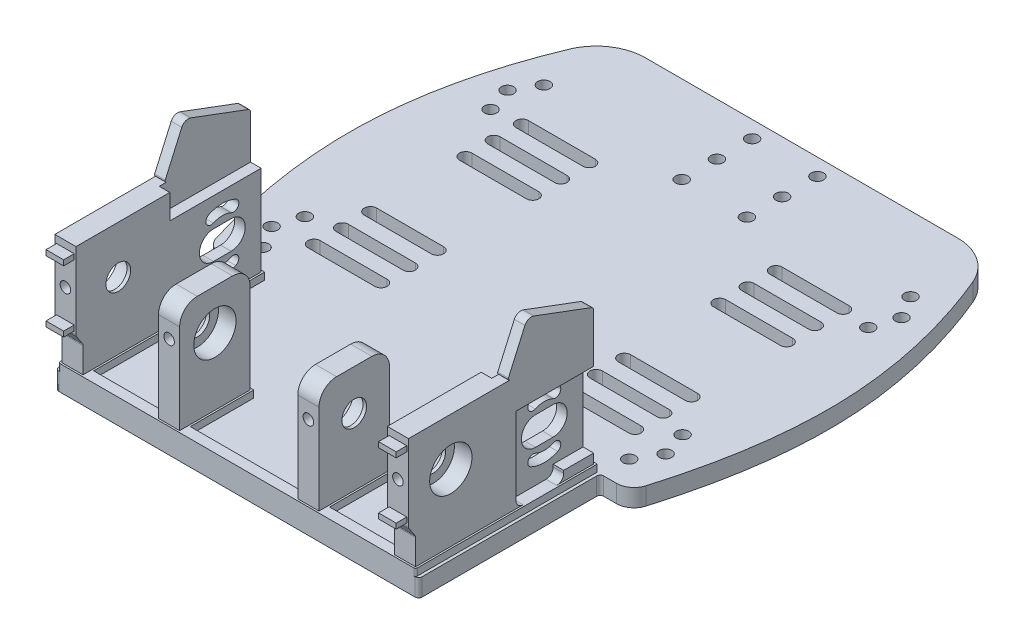
from build123d import *

# Parameters (mm, degrees)
SKETCH_2_R           = 1.75
EXTRUDE_1_DEPTH      = 5
EXTRUDE_2_DEPTH      = 2
SKETCH_7_W           = 6
SKETCH_7_H           = 50.5
EXTRUDE_3_DEPTH      = 39.5
SKETCH_8_W           = 6
SKETCH_8_H           = 20
EXTRUDE_4_DEPTH      = 37.5
FILLET_1_R           = 5
SKETCH_9_R           = 1.5
CUT_EXTRUDE_1_DEPTH  = 4
EXTRUDE_6_DEPTH      = 6
EXTRUDE_START        = -6
EXTRUDE_7_DEPTH      = 6
SKETCH_12_R          = 1.5
CUT_EXTRUDE_2_DEPTH  = 6
EXTRUDE_8_DEPTH      = 3
EXTRUDE_START_2      = -3
EXTRUDE_9_DEPTH      = 3
SKETCH_15_W          = 5
SKETCH_15_H          = 1.5
EXTRUDE_10_DEPTH     = 3
SKETCH_16_W          = 25.9
SKETCH_16_H          = 7
CUT_EXTRUDE_3_DEPTH  = 3
SKETCH_17_W          = 25.9
SKETCH_17_H          = 7
CUT_EXTRUDE_4_DEPTH  = 3
CUT_EXTRUDE_5_DEPTH  = 3
CUT_EXTRUDE_START    = -3
CUT_EXTRUDE_6_DEPTH  = 3
CUT_EXTRUDE_7_DEPTH  = 168.705640987
CUT_EXTRUDE_8_DEPTH  = 168.705640987
SKETCH_26_R          = 3.5
CUT_EXTRUDE_9_DEPTH  = 170.779431891
SKETCH_27_R          = 6
CUT_EXTRUDE_10_DEPTH = 5
CUT_EXTRUDE_START_2  = -5
SKETCH_28_R          = 6
CUT_EXTRUDE_11_DEPTH = 5
SKETCH_29_R          = 6
CUT_EXTRUDE_12_DEPTH = 5
SKETCH_30_R          = 6
CUT_EXTRUDE_13_DEPTH = 5


with BuildPart() as part:
    # 草图2 → 凸台-拉伸1 (new body)
    with BuildSketch(Plane(origin=(0, 0, 0), x_dir=(1, 0, 0), z_dir=(0, 1, 0))):
        with BuildLine():
            Line((56.113755452, -54.3), (52.5, -54.3))
            ThreePointArc((52.5, -54.3), (51.792893219, -54.592893219), (51.5, -55.3))
            Line((51.5, -55.3), (51.5, -104.8))
            ThreePointArc((51.5, -104.8), (51.207106781, -105.507106781), (50.5, -105.8))
            Line((50.5, -105.8), (-50.5, -105.8))
            ThreePointArc((-50.5, -105.8), (-51.207106781, -105.507106781), (-51.5, -104.8))
            Line((-51.5, -104.8), (-51.5, -55.3))
            ThreePointArc((-51.5, -55.3), (-51.792893219, -54.592893219), (-52.5, -54.3))
            Line((-52.5, -54.3), (-56.113755452, -54.3))
            ThreePointArc((-56.113755452, -54.3), (-59.107373243, -53.304778711), (-60.909266171, -50.71530101))
            add(Edge.make_bspline(
                [(-57.171649595, 45.680899892), (-63.360092461, 30.816601844), (-71.169761296, -1.401110068), (-65.950978808, -33.632301117), (-60.909266171, -50.71530101)],
                knots=[0.081627744, 0.081627744, 0.081627744, 0.081627744, 0.502660911, 0.9620676, 0.9620676, 0.9620676, 0.9620676], degree=3))
            ThreePointArc((-57.171649595, 45.680899892), (-52.014502293, 51.947587701), (-44.247025177, 54.3))
            Line((-44.247025177, 54.3), (44.247025177, 54.3))
            ThreePointArc((44.247025177, 54.3), (52.014502293, 51.947587701), (57.171649595, 45.680899892))
            add(Edge.make_bspline(
                [(57.171649595, 45.680899892), (63.360092461, 30.816601844), (71.169761296, -1.401110068), (65.950978808, -33.632301117), (60.909266171, -50.71530101)],
                knots=[0.081627744, 0.081627744, 0.081627744, 0.081627744, 0.502660911, 0.9620676, 0.9620676, 0.9620676, 0.9620676], degree=3))
            ThreePointArc((60.909266171, -50.71530101), (59.107373243, -53.304778711), (56.113755452, -54.3))
        make_face()
        with Locations((-9.25, 49.55)):
            Circle(SKETCH_2_R, mode=Mode.SUBTRACT)
        with Locations((-9.25, 39.55)):
            Circle(SKETCH_2_R, mode=Mode.SUBTRACT)
        with Locations((-9.25, 29.55)):
            Circle(SKETCH_2_R, mode=Mode.SUBTRACT)
        with Locations((-51.988325541, 33.215001872)):
            Circle(SKETCH_2_R, mode=Mode.SUBTRACT)
        with Locations((-55.858759328, 26.79084883)):
            Circle(SKETCH_2_R, mode=Mode.SUBTRACT)
        with Locations((-53.5525482, 19.654225663)):
            Circle(SKETCH_2_R, mode=Mode.SUBTRACT)
        with Locations((-51.988325541, -46.55)):
            Circle(SKETCH_2_R, mode=Mode.SUBTRACT)
        with Locations((-55.858759328, -40.125846958)):
            Circle(SKETCH_2_R, mode=Mode.SUBTRACT)
        with Locations((-53.5525482, -32.989223791)):
            Circle(SKETCH_2_R, mode=Mode.SUBTRACT)
        with Locations((9.25, 39.55)):
            Circle(SKETCH_2_R, mode=Mode.SUBTRACT)
        with Locations((9.25, 49.55)):
            Circle(SKETCH_2_R, mode=Mode.SUBTRACT)
        with Locations((53.5525482, -32.989223791)):
            Circle(SKETCH_2_R, mode=Mode.SUBTRACT)
        with Locations((55.858759328, -40.125846958)):
            Circle(SKETCH_2_R, mode=Mode.SUBTRACT)
        with Locations((51.988325541, -46.55)):
            Circle(SKETCH_2_R, mode=Mode.SUBTRACT)
        with Locations((53.5525482, 19.654225663)):
            Circle(SKETCH_2_R, mode=Mode.SUBTRACT)
        with Locations((55.858759328, 26.79084883)):
            Circle(SKETCH_2_R, mode=Mode.SUBTRACT)
        with Locations((51.988325541, 33.215001872)):
            Circle(SKETCH_2_R, mode=Mode.SUBTRACT)
        with Locations((9.25, 29.55)):
            Circle(SKETCH_2_R, mode=Mode.SUBTRACT)
        with BuildLine():
            Line((-26.5, 18.8), (-45.5, 18.8))
            ThreePointArc((-45.5, 18.8), (-47.25, 20.55), (-45.5, 22.3))
            Line((-45.5, 22.3), (-26.5, 22.3))
            ThreePointArc((-26.5, 22.3), (-24.75, 20.55), (-26.5, 18.8))
        make_face(mode=Mode.SUBTRACT)
        with BuildLine():
            Line((-26.5, 10.8), (-45.5, 10.8))
            ThreePointArc((-45.5, 10.8), (-47.25, 12.55), (-45.5, 14.3))
            Line((-45.5, 14.3), (-26.5, 14.3))
            ThreePointArc((-26.5, 14.3), (-24.75, 12.55), (-26.5, 10.8))
        make_face(mode=Mode.SUBTRACT)
        with BuildLine():
            Line((-26.5, 2.8), (-45.5, 2.8))
            ThreePointArc((-45.5, 2.8), (-47.25, 4.55), (-45.5, 6.3))
            Line((-45.5, 6.3), (-26.5, 6.3))
            ThreePointArc((-26.5, 6.3), (-24.75, 4.55), (-26.5, 2.8))
        make_face(mode=Mode.SUBTRACT)
        with BuildLine():
            Line((-45.5, -20.7), (-26.5, -20.7))
            ThreePointArc((-26.5, -20.7), (-24.75, -22.45), (-26.5, -24.2))
            Line((-26.5, -24.2), (-45.5, -24.2))
            ThreePointArc((-45.5, -24.2), (-47.25, -22.45), (-45.5, -20.7))
        make_face(mode=Mode.SUBTRACT)
        with BuildLine():
            Line((-45.5, -28.7), (-26.5, -28.7))
            ThreePointArc((-26.5, -28.7), (-24.75, -30.45), (-26.5, -32.2))
            Line((-26.5, -32.2), (-45.5, -32.2))
            ThreePointArc((-45.5, -32.2), (-47.25, -30.45), (-45.5, -28.7))
        make_face(mode=Mode.SUBTRACT)
        with BuildLine():
            Line((-45.5, -36.7), (-26.5, -36.7))
            ThreePointArc((-26.5, -36.7), (-24.75, -38.45), (-26.5, -40.2))
            Line((-26.5, -40.2), (-45.5, -40.2))
            ThreePointArc((-45.5, -40.2), (-47.25, -38.45), (-45.5, -36.7))
        make_face(mode=Mode.SUBTRACT)
        with BuildLine():
            Line((26.5, 18.8), (45.5, 18.8))
            ThreePointArc((45.5, 18.8), (47.25, 20.55), (45.5, 22.3))
            Line((45.5, 22.3), (26.5, 22.3))
            ThreePointArc((26.5, 22.3), (24.75, 20.55), (26.5, 18.8))
        make_face(mode=Mode.SUBTRACT)
        with BuildLine():
            Line((26.5, 10.8), (45.5, 10.8))
            ThreePointArc((45.5, 10.8), (47.25, 12.55), (45.5, 14.3))
            Line((45.5, 14.3), (26.5, 14.3))
            ThreePointArc((26.5, 14.3), (24.75, 12.55), (26.5, 10.8))
        make_face(mode=Mode.SUBTRACT)
        with BuildLine():
            Line((26.5, 2.8), (45.5, 2.8))
            ThreePointArc((45.5, 2.8), (47.25, 4.55), (45.5, 6.3))
            Line((45.5, 6.3), (26.5, 6.3))
            ThreePointArc((26.5, 6.3), (24.75, 4.55), (26.5, 2.8))
        make_face(mode=Mode.SUBTRACT)
        with BuildLine():
            Line((45.5, -20.7), (26.5, -20.7))
            ThreePointArc((26.5, -20.7), (24.75, -22.45), (26.5, -24.2))
            Line((26.5, -24.2), (45.5, -24.2))
            ThreePointArc((45.5, -24.2), (47.25, -22.45), (45.5, -20.7))
        make_face(mode=Mode.SUBTRACT)
        with BuildLine():
            Line((45.5, -28.7), (26.5, -28.7))
            ThreePointArc((26.5, -28.7), (24.75, -30.45), (26.5, -32.2))
            Line((26.5, -32.2), (45.5, -32.2))
            ThreePointArc((45.5, -32.2), (47.25, -30.45), (45.5, -28.7))
        make_face(mode=Mode.SUBTRACT)
        with BuildLine():
            Line((45.5, -36.7), (26.5, -36.7))
            ThreePointArc((26.5, -36.7), (24.75, -38.45), (26.5, -40.2))
            Line((26.5, -40.2), (45.5, -40.2))
            ThreePointArc((45.5, -40.2), (47.25, -38.45), (45.5, -36.7))
        make_face(mode=Mode.SUBTRACT)
    extrude(amount=EXTRUDE_1_DEPTH)

    # 草图5 → 凸台-拉伸2 (add)
    with BuildSketch(Plane(origin=(0, 5, 0), x_dir=(1, 0, 0), z_dir=(0, 1, 0))):
        with BuildLine():
            Line((-43.65, -105.8), (43.65, -105.8))
            Line((43.65, -105.8), (50.15, -105.8))
            ThreePointArc((50.15, -105.8), (50.503553391, -105.653553391), (50.65, -105.3))
            Line((50.65, -105.3), (50.65, -54.3))
            Line((50.65, -54.3), (43.65, -54.3))
            Line((43.65, -54.3), (43.65, -102.8))
            Line((43.65, -102.8), (23.25, -102.8))
            Line((23.25, -102.8), (23.25, -84.8))
            Line((23.25, -84.8), (16.25, -84.8))
            Line((16.25, -84.8), (16.25, -102.8))
            Line((16.25, -102.8), (-16.25, -102.8))
            Line((-16.25, -102.8), (-16.25, -84.8))
            Line((-16.25, -84.8), (-23.25, -84.8))
            Line((-23.25, -84.8), (-23.25, -102.8))
            Line((-23.25, -102.8), (-43.65, -102.8))
            Line((-43.65, -102.8), (-43.65, -54.3))
            Line((-43.65, -54.3), (-50.65, -54.3))
            Line((-50.65, -54.3), (-50.65, -105.3))
            ThreePointArc((-50.65, -105.3), (-50.503553391, -105.653553391), (-50.15, -105.8))
            Line((-50.15, -105.8), (-43.65, -105.8))
        make_face()
    extrude(amount=EXTRUDE_2_DEPTH)

    # 草图7 → 凸台-拉伸3 (add)
    with BuildSketch(Plane.XZ):
        with Locations((-47.15, 80.05)):
            Rectangle(SKETCH_7_W, SKETCH_7_H)
        with Locations((47.15, 80.05)):
            Rectangle(SKETCH_7_W, SKETCH_7_H)
    extrude(amount=-EXTRUDE_3_DEPTH)

    # 草图8 → 凸台-拉伸4 (add)
    with BuildSketch(Plane.XZ):
        with Locations((-19.75, 95.3)):
            Rectangle(SKETCH_8_W, SKETCH_8_H)
        with Locations((19.75, 95.3)):
            Rectangle(SKETCH_8_W, SKETCH_8_H)
    extrude(amount=-EXTRUDE_4_DEPTH)

    # 圆角1
    fillet_1_edges = [part.edges().sort_by_distance(p)[0] for p in [
        (19.75, 37.5, 85.3),
        (19.75, 37.5, 105.3),
        (-19.75, 37.5, 85.3),
        (-19.75, 37.5, 105.3),
    ]]
    fillet(fillet_1_edges, radius=FILLET_1_R)

    # 草图9 → 切除-拉伸1 (cut)
    with BuildSketch(Plane.XY.offset(105.3)):
        with Locations((19.75, 28)):
            Circle(SKETCH_9_R)
        with Locations((-19.75, 28)):
            Circle(SKETCH_9_R)
    extrude(amount=-CUT_EXTRUDE_1_DEPTH, mode=Mode.SUBTRACT)

    # 草图10 → 凸台-拉伸6 (add)
    with BuildSketch(Plane(origin=(50.15, 0, 0), x_dir=(0, 0, -1), z_dir=(1, 0, 0))):
        with BuildLine():
            Line((-107.3, 39.5), (-107.3, 17.802775638))
            ThreePointArc((-107.3, 17.802775638), (-107.257092026, 17.512991489), (-107.132050294, 17.248075442))
            Line((-107.132050294, 17.248075442), (-105.467949706, 14.751924558))
            ThreePointArc((-105.467949706, 14.751924558), (-105.342907974, 14.487008511), (-105.3, 14.197224362))
            Line((-105.3, 14.197224362), (-105.3, 7))
            Line((-105.3, 7), (-102.8, 7))
            Line((-102.8, 7), (-102.8, 39.5))
            Line((-102.8, 39.5), (-107.3, 39.5))
        make_face()
    extrude(amount=-EXTRUDE_6_DEPTH)

    # 草图11 → 凸台-拉伸7 (add)
    with BuildSketch(Plane.ZY.offset(50.15).offset(EXTRUDE_START)):
        with BuildLine():
            Line((107.3, 17.802775638), (107.3, 39.5))
            Line((107.3, 39.5), (102.8, 39.5))
            Line((102.8, 39.5), (102.8, 7))
            Line((102.8, 7), (105.3, 7))
            Line((105.3, 7), (105.3, 14.197224362))
            ThreePointArc((105.3, 14.197224362), (105.342907974, 14.487008511), (105.467949706, 14.751924558))
            Line((105.467949706, 14.751924558), (107.132050294, 17.248075442))
            ThreePointArc((107.132050294, 17.248075442), (107.257092026, 17.512991489), (107.3, 17.802775638))
        make_face()
    extrude(amount=EXTRUDE_7_DEPTH)

    # 草图12 → 切除-拉伸2 (cut)
    with BuildSketch(Plane.XY.offset(107.3)):
        with Locations((-47.15, 28)):
            Circle(SKETCH_12_R)
        with Locations((47.15, 28)):
            Circle(SKETCH_12_R)
    extrude(amount=-CUT_EXTRUDE_2_DEPTH, mode=Mode.SUBTRACT)

    # 草图13 → 凸台-拉伸8 (add)
    with BuildSketch(Plane(origin=(50.15, 0, 0), x_dir=(0, 0, -1), z_dir=(1, 0, 0))):
        with BuildLine():
            Line((-54.8, 39.5), (-78.531309553, 39.5))
            ThreePointArc((-78.531309553, 39.5), (-78.950443835, 39.727371217), (-78.98838183, 40.202694186))
            Line((-78.98838183, 40.202694186), (-74.298655372, 50.777955324))
            ThreePointArc((-74.298655372, 50.777955324), (-73.245352674, 51.810923696), (-71.770366262, 51.840677978))
            Line((-71.770366262, 51.840677978), (-55.45, 45.742861033))
            ThreePointArc((-55.45, 45.742861033), (-54.978416164, 45.376199046), (-54.8, 44.806111334))
            Line((-54.8, 44.806111334), (-54.8, 39.5))
        make_face()
    extrude(amount=-EXTRUDE_8_DEPTH)

    # 草图14 → 凸台-拉伸9 (add)
    with BuildSketch(Plane.ZY.offset(50.15).offset(EXTRUDE_START_2)):
        with BuildLine():
            Line((54.8, 44.806111334), (54.8, 39.5))
            Line((54.8, 39.5), (78.531309553, 39.5))
            ThreePointArc((78.531309553, 39.5), (78.950443835, 39.727371217), (78.98838183, 40.202694186))
            Line((78.98838183, 40.202694186), (74.298655372, 50.777955324))
            ThreePointArc((74.298655372, 50.777955324), (73.245352674, 51.810923696), (71.770366262, 51.840677978))
            Line((71.770366262, 51.840677978), (55.45, 45.742861033))
            ThreePointArc((55.45, 45.742861033), (54.978416164, 45.376199046), (54.8, 44.806111334))
        make_face()
    extrude(amount=EXTRUDE_9_DEPTH)

    # 草图15 → 凸台-拉伸10 (add)
    with BuildSketch(Plane.XY.offset(107.3)):
        with Locations((-47.15, 36.75)):
            Rectangle(SKETCH_15_W, SKETCH_15_H)
        with Locations((-47.15, 19.25)):
            Rectangle(SKETCH_15_W, SKETCH_15_H)
        with Locations((47.15, 19.25)):
            Rectangle(SKETCH_15_W, SKETCH_15_H)
        with Locations((47.15, 36.75)):
            Rectangle(SKETCH_15_W, SKETCH_15_H)
    extrude(amount=EXTRUDE_10_DEPTH)

    # 草图16 → 切除-拉伸3 (cut)
    with BuildSketch(Plane.ZY.offset(-44.15)):
        with Locations((67.75, 36)):
            Rectangle(SKETCH_16_W, SKETCH_16_H)
    extrude(amount=-CUT_EXTRUDE_3_DEPTH, mode=Mode.SUBTRACT)

    # 草图17 → 切除-拉伸4 (cut)
    with BuildSketch(Plane(origin=(-44.15, 0, 0), x_dir=(0, 0, -1), z_dir=(1, 0, 0))):
        with Locations((-67.75, 36)):
            Rectangle(SKETCH_17_W, SKETCH_17_H)
    extrude(amount=-CUT_EXTRUDE_4_DEPTH, mode=Mode.SUBTRACT)

    # 草图18 → 切除-拉伸5 (cut)
    with BuildSketch(Plane(origin=(50.15, 0, 0), x_dir=(0, 0, -1), z_dir=(1, 0, 0))):
        with BuildLine():
            Line((-54.8, 31), (-76.8, 31))
            Line((-76.8, 31), (-76.8, 9))
            ThreePointArc((-76.8, 9), (-76.214213562, 7.585786438), (-74.8, 7))
            Line((-74.8, 7), (-65.3, 7))
            ThreePointArc((-65.3, 7), (-63.885786438, 7.585786438), (-63.3, 9))
            Line((-63.3, 9), (-63.3, 9.706166138))
            Line((-63.3, 9.706166138), (-54.8, 9.706166138))
            Line((-54.8, 9.706166138), (-54.8, 31))
        make_face()
    extrude(amount=-CUT_EXTRUDE_5_DEPTH, mode=Mode.SUBTRACT)

    # 草图19 → 切除-拉伸6 (cut)
    with BuildSketch(Plane.ZY.offset(50.15).offset(CUT_EXTRUDE_START)):
        with BuildLine():
            Line((65.3, 7), (74.8, 7))
            ThreePointArc((74.8, 7), (76.214213562, 7.585786438), (76.8, 9))
            Line((76.8, 9), (76.8, 31))
            Line((76.8, 31), (54.8, 31))
            Line((54.8, 31), (54.8, 9.706166138))
            Line((54.8, 9.706166138), (63.3, 9.706166138))
            Line((63.3, 9.706166138), (63.3, 9))
            ThreePointArc((63.3, 9), (63.885786438, 7.585786438), (65.3, 7))
        make_face()
    extrude(amount=CUT_EXTRUDE_6_DEPTH, mode=Mode.SUBTRACT)

    # 草图23 → 切除-拉伸7 (cut, through all)
    with BuildSketch(Plane(origin=(47.15, 0, 0), x_dir=(0, 0, -1), z_dir=(1, 0, 0))):
        with BuildLine():
            Line((-68.3, 24.353083069), (-63.3, 24.353083069))
            ThreePointArc((-63.3, 24.353083069), (-59.3, 20.353083069), (-63.3, 16.353083069))
            Line((-63.3, 16.353083069), (-68.3, 16.353083069))
            ThreePointArc((-68.3, 16.353083069), (-72.3, 20.353083069), (-68.3, 24.353083069))
        make_face()
    extrude(amount=-CUT_EXTRUDE_7_DEPTH, mode=Mode.SUBTRACT)

    # 草图24 → 切除-拉伸8 (cut, through all)
    with BuildSketch(Plane(origin=(47.15, 0, 0), x_dir=(0, 0, -1), z_dir=(1, 0, 0))):
        with BuildLine():
            ThreePointArc((-61.996435644, 28.509853153), (-65.8, 29.353083069), (-69.603564356, 28.509853153))
            ThreePointArc((-69.603564356, 28.509853153), (-70.329098644, 26.516464079), (-68.33570957, 25.790929791))
            ThreePointArc((-68.33570957, 25.790929791), (-65.8, 26.353083069), (-63.26429043, 25.790929791))
            ThreePointArc((-63.26429043, 25.790929791), (-61.270901356, 26.516464079), (-61.996435644, 28.509853153))
        make_face()
        with BuildLine():
            ThreePointArc((-61.996435644, 12.196312986), (-65.8, 11.353083069), (-69.603564356, 12.196312986))
            ThreePointArc((-69.603564356, 12.196312986), (-70.329098644, 14.189702059), (-68.33570957, 14.915236347))
            ThreePointArc((-68.33570957, 14.915236347), (-65.8, 14.353083069), (-63.26429043, 14.915236347))
            ThreePointArc((-63.26429043, 14.915236347), (-61.270901356, 14.189702059), (-61.996435644, 12.196312986))
        make_face()
    extrude(amount=-CUT_EXTRUDE_8_DEPTH, mode=Mode.SUBTRACT)

    # 草图26 → 切除-拉伸9 (cut, through all)
    with BuildSketch(Plane(origin=(50.15, 0, 0), x_dir=(0, 0, -1), z_dir=(1, 0, 0))):
        with Locations((-95.3, 26)):
            Circle(SKETCH_26_R)
    extrude(amount=-CUT_EXTRUDE_9_DEPTH, mode=Mode.SUBTRACT)

    # 草图27 → 切除-拉伸10 (cut)
    with BuildSketch(Plane.ZY.offset(-16.75)):
        with Locations((95.3, 26)):
            Circle(SKETCH_27_R)
    extrude(amount=-CUT_EXTRUDE_10_DEPTH, mode=Mode.SUBTRACT)

    # 草图28 → 切除-拉伸11 (cut)
    with BuildSketch(Plane(origin=(-16.75, 0, 0), x_dir=(0, 0, -1), z_dir=(1, 0, 0)).offset(CUT_EXTRUDE_START_2)):
        with Locations((-95.3, 26)):
            Circle(SKETCH_28_R)
    extrude(amount=CUT_EXTRUDE_11_DEPTH, mode=Mode.SUBTRACT)

    # 草图29 → 切除-拉伸12 (cut)
    with BuildSketch(Plane.ZY.offset(50.15)):
        with Locations((95.3, 26)):
            Circle(SKETCH_29_R)
    extrude(amount=-CUT_EXTRUDE_12_DEPTH, mode=Mode.SUBTRACT)

    # 草图30 → 切除-拉伸13 (cut)
    with BuildSketch(Plane(origin=(50.15, 0, 0), x_dir=(0, 0, -1), z_dir=(1, 0, 0)).offset(CUT_EXTRUDE_START_2)):
        with Locations((-95.3, 26)):
            Circle(SKETCH_30_R)
    extrude(amount=CUT_EXTRUDE_13_DEPTH, mode=Mode.SUBTRACT)


solid = part.part
